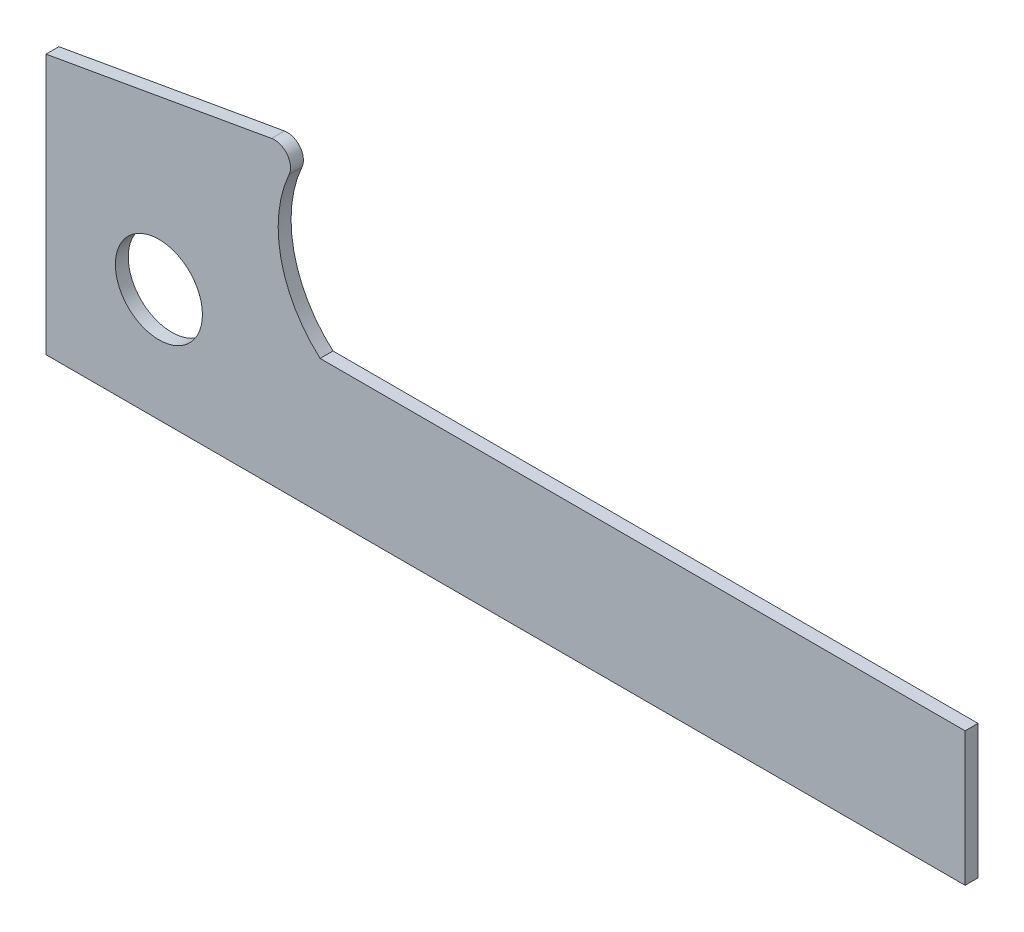
from build123d import *

# Parameters (mm, degrees)
SKETCH_1_R             = 13.5
SM_BASE_FLANGE_1_DEPTH = 4


# Sheet-metal steps are written as plain solids
with BuildPart() as part:
    # Sketch 1 → Базовая кромка1 (new body)
    with BuildSketch(Plane.XY):
        with BuildLine():
            Line((0, -35), (250, -35))
            Line((250, -35), (250, 6.5))
            Line((250, 6.5), (50, 6.5))
            ThreePointArc((50, 6.5), (37.854703837, 27.206009472), (40.376084675, 51.078371856))
            ThreePointArc((40.376084675, 51.078371856), (39.763461316, 56.201257152), (34.948705483, 58.055276407))
            Line((34.948705483, 58.055276407), (-35, 45.721432364))
            Line((-35, 45.721432364), (-35, -35))
            Line((-35, -35), (0, -35))
        make_face()
        Circle(SKETCH_1_R, mode=Mode.SUBTRACT)
    extrude(amount=-SM_BASE_FLANGE_1_DEPTH)


solid = part.part
